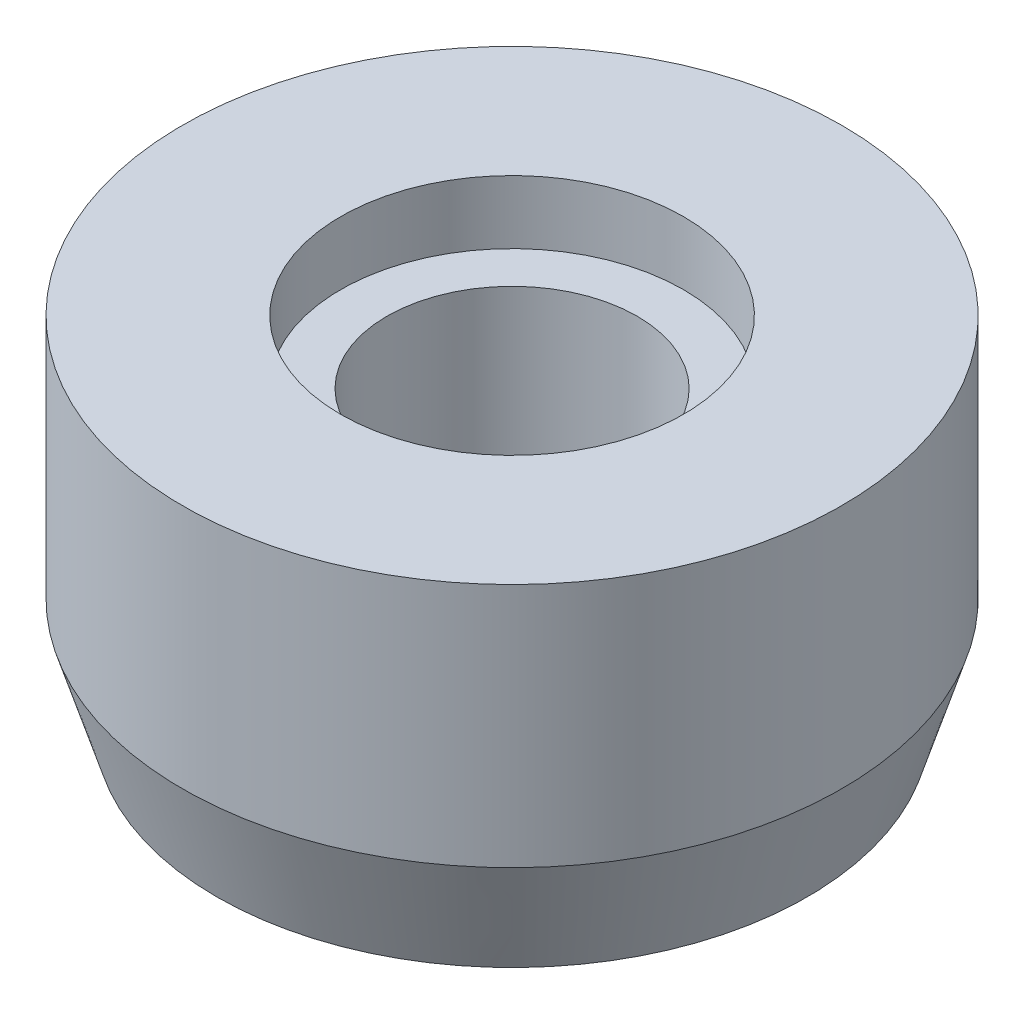
from build123d import *


with BuildPart() as part:
    # Sketch1 → Revolve1 (revolve)
    with BuildSketch(Plane.XY):
        Polygon((12.5, 0), (6.5, 0), (6.5, -2.4), (4.75, -2.4), (4.75, -13.5), (11.2, -13.5), (12.5, -9.3), align=None)
    revolve(axis=Axis((0, -13.5, 0), (0, 1, 0)))


solid = part.part
